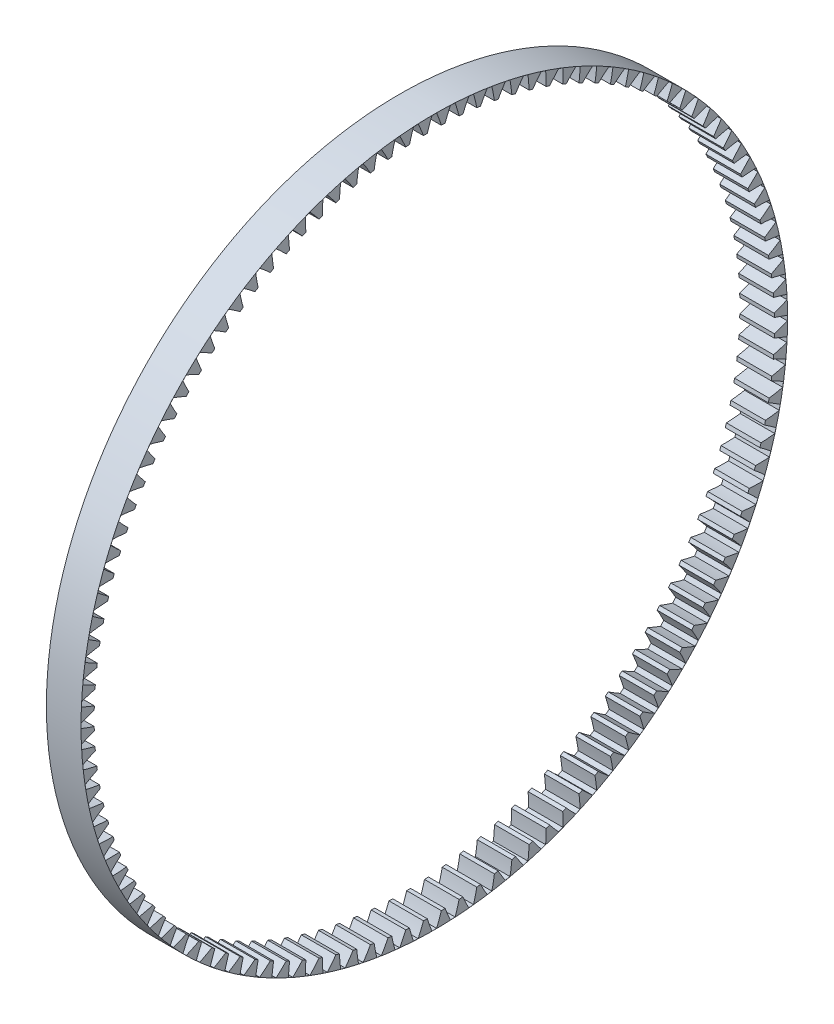
from build123d import *

# Parameters (mm, degrees)
BASPROSKE_W     = 6
BASPROSKE_H     = 2.2764
TOOTHCUT_DEPTH  = 87.865380871
TEETHCUTS_COUNT = 120
TEETHCUTS_ANGLE = 357


with BuildPart() as part:
    # BasProSke → Base-Revolve (revolve)
    with BuildSketch(Plane(origin=(0, 0, 0), x_dir=(1, 0, 0), z_dir=(0, 1, 0))):
        with Locations((3, 60.1382)):
            Rectangle(BASPROSKE_W, BASPROSKE_H)
    revolve(axis=Axis((-10, 0, 0), (1, 0, 0)))

    # TooCutSke → ToothCut (cut, through all)
    with BuildSketch(Plane(origin=(0, 0, 0), x_dir=(0, 0, -1), z_dir=(1, 0, 0))):
        with BuildLine():
            ThreePointArc((1.222221041, 58.96193366), (0.837717971, 60.114045071), (0.406895219, 61.249648467))
            ThreePointArc((0.406895219, 61.249648467), (0, 61.251), (-0.406895219, 61.249648467))
            ThreePointArc((-0.406895219, 61.249648467), (-0.837717971, 60.114045071), (-1.222221041, 58.96193366))
            ThreePointArc((-1.222221041, 58.96193366), (0, 58.9746), (1.222221041, 58.96193366))
        make_face()
    toothcut = extrude(amount=TOOTHCUT_DEPTH, mode=Mode.SUBTRACT)

    # TeethCuts: ToothCut ×120 about axis
    teethcuts_axis = Axis((-10, 0, 0), (1, 0, 0))
    for i in range(1, TEETHCUTS_COUNT):
        add(toothcut.rotate(teethcuts_axis, i * TEETHCUTS_ANGLE / (TEETHCUTS_COUNT - 1)), mode=Mode.SUBTRACT)


solid = part.part
